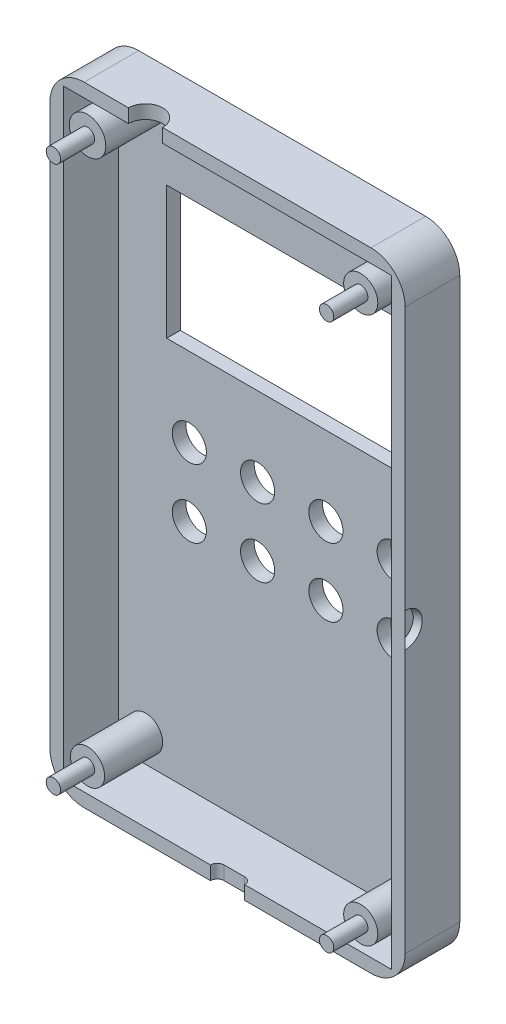
from build123d import *

# Parameters (mm, degrees)
SKETCH1_W           = 52
SKETCH1_H           = 92
SKETCH1_W_2         = 48
SKETCH1_H_2         = 88
EXTRUDE_THIN1_DEPTH = 8
SKETCH2_W           = 48
SKETCH2_H           = 88
BOSS_EXTRUDE1_DEPTH = 2
SKETCH4_W           = 34.729851986
SKETCH4_H           = 19.422991295
CUT_EXTRUDE1_DEPTH  = 2
SKETCH5_R           = 2.5
CUT_EXTRUDE2_DEPTH  = 2
FILLET2_R           = 5
SKETCH6_R           = 1.05
BOSS_EXTRUDE2_DEPTH = 13.5
SKETCH7_R           = 2.67
SKETCH7_R_2         = 1.05
SKETCH7_R_3         = 2.5
SKETCH7_R_4         = 0.991419058
BOSS_EXTRUDE3_DEPTH = 8.5
FILLET3_R           = 3
SKETCH8_R           = 2.5
CUT_EXTRUDE3_DEPTH  = 10
SKETCH9_W           = 5
SKETCH9_H           = 2
CUT_EXTRUDE4_DEPTH  = 10
FILLET4_R           = 1
CUT_EXTRUDE5_DEPTH  = 1
CUT_EXTRUDE5_DRAFT  = -17
CUT_EXTRUDE6_DEPTH  = 1
CUT_EXTRUDE6_DRAFT  = -17


# Some blends are built 0.0001 mm under size
with BuildPart() as part:
    # Sketch1 → Extrude-Thin1 (new body)
    with BuildSketch(Plane.XY):
        Rectangle(SKETCH1_W, SKETCH1_H)
        Rectangle(SKETCH1_W_2, SKETCH1_H_2, mode=Mode.SUBTRACT)
    extrude(amount=EXTRUDE_THIN1_DEPTH)

    # Fillet2
    fillet2_edges = [part.edges().sort_by_distance(p)[0] for p in [
        (26, -46, 4),
        (-26, -46, 4),
        (-26, 46, 4),
        (26, 46, 4),
    ]]
    fillet(fillet2_edges, radius=FILLET2_R)

    # Sketch8 → Cut-Extrude3 (cut)
    with BuildSketch(Plane(origin=(0, 46, 0), x_dir=(1, 0, 0), z_dir=(0, 1, 0))):
        with Locations((-12, -8)):
            Circle(SKETCH8_R)
    extrude(amount=-CUT_EXTRUDE3_DEPTH, mode=Mode.SUBTRACT)

    # Sketch9 → Cut-Extrude4 (cut)
    with BuildSketch(Plane.XZ.offset(46)):
        with Locations((0, 8)):
            Rectangle(SKETCH9_W, SKETCH9_H)
    extrude(amount=-CUT_EXTRUDE4_DEPTH, mode=Mode.SUBTRACT)

    # Fillet4
    fillet4_edges = [part.edges().sort_by_distance(p)[0] for p in [
        (-2.5, -45, 7),
        (2.5, -45, 7),
    ]]
    fillet(fillet4_edges, radius=FILLET4_R - 0.0001)  # a hair under: the kernel refuses the full size


with BuildPart() as body_2:
    # Sketch2 → Boss-Extrude1 (new body)
    with BuildSketch(Plane.XY):
        Rectangle(SKETCH2_W, SKETCH2_H)
    extrude(amount=-BOSS_EXTRUDE1_DEPTH)

    # Sketch4 → Cut-Extrude1 (cut)
    with BuildSketch(Plane(origin=(0, 0, -2), x_dir=(-1, 0, 0), z_dir=(0, 0, -1))):
        with Locations((-0.450201785, 21.288504353)):
            Rectangle(SKETCH4_W, SKETCH4_H)
    extrude(amount=-CUT_EXTRUDE1_DEPTH, mode=Mode.SUBTRACT)

    # Sketch5 → Cut-Extrude2 (cut)
    with BuildSketch(Plane(origin=(0, 0, -2), x_dir=(-1, 0, 0), z_dir=(0, 0, -1))):
        with Locations((-16.400207882, 0)):
            Circle(SKETCH5_R)
        with Locations((-6.400207882, 0)):
            Circle(SKETCH5_R)
        with Locations((3.599792118, 0)):
            Circle(SKETCH5_R)
        with Locations((13.599792118, 0)):
            Circle(SKETCH5_R)
        with Locations((-6.400207882, -10)):
            Circle(SKETCH5_R)
        with Locations((3.599792118, -10)):
            Circle(SKETCH5_R)
        with Locations((13.599792118, -10)):
            Circle(SKETCH5_R)
        with Locations((-16.400207882, -10)):
            Circle(SKETCH5_R)
    extrude(amount=-CUT_EXTRUDE2_DEPTH, mode=Mode.SUBTRACT)

    # Sketch6 → Boss-Extrude2 (add)
    with BuildSketch(Plane.XY):
        with Locations((-20, 40)):
            Circle(SKETCH6_R)
        with Locations((-20, -40)):
            Circle(SKETCH6_R)
        with Locations((20, 40)):
            Circle(SKETCH6_R)
        with Locations((20, -40)):
            Circle(SKETCH6_R)
    extrude(amount=BOSS_EXTRUDE2_DEPTH)

    # Sketch7 → Boss-Extrude3 (add)
    # profile 1 of 4: a face of its own
    with BuildSketch(Plane.XY):
        with Locations((-20, 40)):
            Circle(SKETCH7_R)
        with Locations((-20, 40)):
            Circle(SKETCH7_R_2, mode=Mode.SUBTRACT)
    # profile 2 of 4: a face of its own
    with BuildSketch(Plane.XY):
        with Locations((20, 40)):
            Circle(SKETCH7_R_3)
        with Locations((20, 40)):
            Circle(SKETCH7_R_2, mode=Mode.SUBTRACT)
    # profile 3 of 4: a face of its own
    with BuildSketch(Plane.XY):
        with Locations((-20, -40)):
            Circle(SKETCH7_R_3)
        with Locations((-20, -40)):
            Circle(SKETCH7_R_2, mode=Mode.SUBTRACT)
    # profile 4 of 4: a face of its own
    with BuildSketch(Plane.XY):
        with Locations((20, -40)):
            Circle(SKETCH7_R_3)
        with Locations((20, -40)):
            Circle(SKETCH7_R_4, mode=Mode.SUBTRACT)
    extrude(amount=BOSS_EXTRUDE3_DEPTH)

    # Fillet3
    # the kernel refuses this fillet: 3 mm, written as the material it takes off along each edge
    with BuildSketch(Plane(origin=(31.071067812, -44, -2), x_dir=(0, 1, 0), z_dir=(-1, 0, 0))) as fillet3_piece_1:
        with BuildLine():
            CenterArc((2.828427125, -3), FILLET3_R, 90, 70.528779366)
            Line((0, -2), (-0.056568542, -1.98))
            ThreePointArc((-0.056568542, -1.98), (-0.06, -1), (-0.06, 0))
            Line((-0.06, 0), (0, 0.06))
            Line((0, 0.06), (2.828427125, 0.06))
            Line((2.828427125, 0.06), (2.828427125, 0))
        make_face()
    extrude(amount=62.142135624, mode=Mode.SUBTRACT)
    with BuildSketch(Plane(origin=(24, 51.071067812, -2), x_dir=(0, 0, 1), z_dir=(0, -1, 0)), Plane(origin=(-24, -51.071067812, -2), x_dir=(0, 0, 1), z_dir=(0, 1, 0))) as fillet3_piece_2:
        with BuildLine():
            CenterArc((3, 2.828427125), FILLET3_R, 180, 70.528779366)
            Line((0, 2.828427125), (-0.06, 2.828427125))
            Line((-0.06, 2.828427125), (-0.06, 0))
            Line((-0.06, 0), (0, -0.06))
            ThreePointArc((0, -0.06), (1, -0.06), (1.98, -0.056568542))
            Line((1.98, -0.056568542), (2, 0))
        make_face()
    extrude(amount=102.142135624, mode=Mode.SUBTRACT)
    with BuildSketch(Plane(origin=(-31.071067812, 44, -2), x_dir=(0, 0, 1), z_dir=(1, 0, 0))) as fillet3_piece_3:
        with BuildLine():
            CenterArc((3, 2.828427125), FILLET3_R, 180, 70.528779366)
            Line((0, 2.828427125), (-0.06, 2.828427125))
            Line((-0.06, 2.828427125), (-0.06, 0))
            Line((-0.06, 0), (0, -0.06))
            ThreePointArc((0, -0.06), (1, -0.06), (1.98, -0.056568542))
            Line((1.98, -0.056568542), (2, 0))
        make_face()
    extrude(amount=62.142135624, mode=Mode.SUBTRACT)


with BuildPart() as cut_extrude5_tool:
    # Sketch10 → Cut-Extrude5 (with draft: the straight prism first)
    with BuildSketch(Plane.ZY.offset(26)):
        with BuildLine():
            ThreePointArc((8, 2.5), (5.5, 0), (8, -2.5))
            Line((8, -2.5), (8, 2.5))
        make_face()
    extrude(amount=-CUT_EXTRUDE5_DEPTH)
    # Cut-Extrude5: the draft: its side faces are tilted about the plane it starts from
    cut_extrude5_sides = [cut_extrude5_tool.faces().sort_by_distance(p)[0] for p in [
        (-25.5, 0, 5.5),
        (-25.5, 0, 8),
    ]]
    draft(cut_extrude5_sides, Plane.ZY.offset(26), CUT_EXTRUDE5_DRAFT)


with BuildPart() as part_1:
    add(part.part)

    # Cut-Extrude5: cut by cut_extrude5_tool
    add(cut_extrude5_tool.part, mode=Mode.SUBTRACT)


with BuildPart() as cut_extrude6_tool:
    # Sketch11 → Cut-Extrude6 (with draft: the straight prism first)
    with BuildSketch(Plane(origin=(26, 0, 0), x_dir=(0, 0, -1), z_dir=(1, 0, 0))):
        with BuildLine():
            Line((-8, 2.5), (-8, -2.5))
            ThreePointArc((-8, -2.5), (-5.5, 0), (-8, 2.5))
        make_face()
    extrude(amount=-CUT_EXTRUDE6_DEPTH)
    # Cut-Extrude6: the draft: its side faces are tilted about the plane it starts from
    cut_extrude6_sides = [cut_extrude6_tool.faces().sort_by_distance(p)[0] for p in [
        (25.5, 0, 8),
        (25.5, 0, 5.5),
    ]]
    draft(cut_extrude6_sides, Plane(origin=(26, 0, 0), x_dir=(0, 0, -1), z_dir=(1, 0, 0)), CUT_EXTRUDE6_DRAFT)


with BuildPart() as part_2:
    add(part_1.part)

    # Cut-Extrude6: cut by cut_extrude6_tool
    add(cut_extrude6_tool.part, mode=Mode.SUBTRACT)


solid = Compound([body_2.part, part_2.part])
